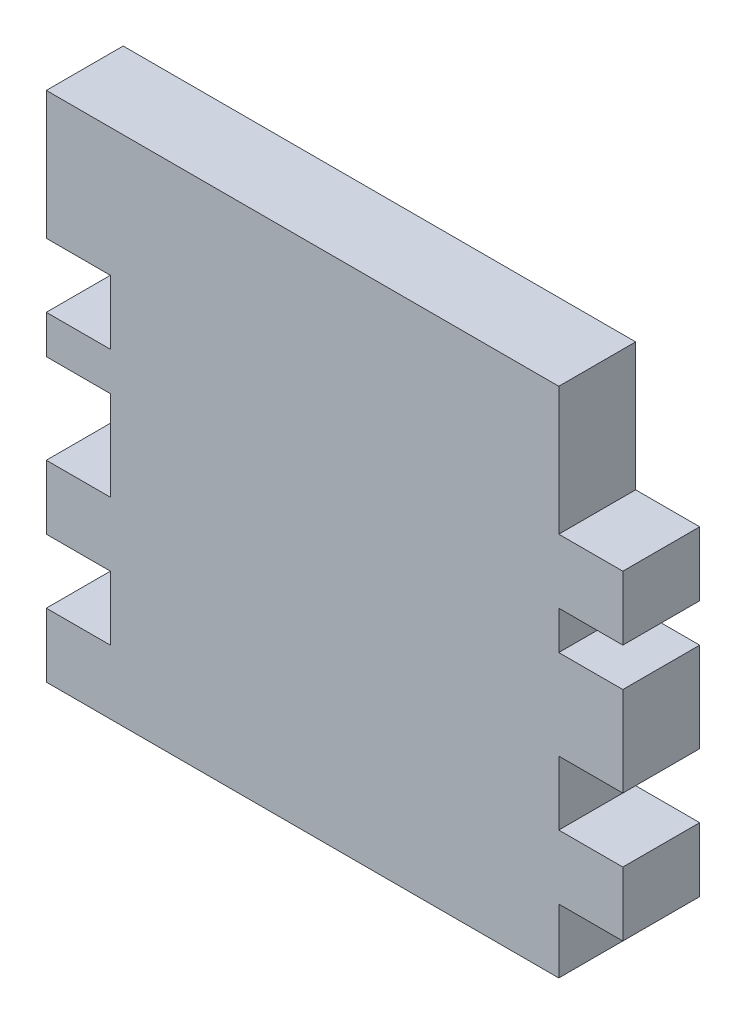
from build123d import *

# Parameters (mm, degrees)
SKETCH1_W           = 45
SKETCH1_H           = 40
BOSS_EXTRUDE1_DEPTH = 6
SKETCH2_W           = 5
SKETCH2_H           = 5
SKETCH2_H_2         = 7
CUT_EXTRUDE1_DEPTH  = 6
SKETCH3_W           = 5
SKETCH3_H           = 5
SKETCH3_H_2         = 7
CUT_EXTRUDE3_DEPTH  = 6
SKETCH3_4_W         = 5
SKETCH3_4_H         = 5
SKETCH3_4_H_2       = 7
BOSS_EXTRUDE3_DEPTH = 6
SKETCH3_5_W         = 5
SKETCH3_5_H         = 3
SKETCH3_5_H_2       = 10
SKETCH3_5_H_3       = 5
CUT_EXTRUDE4_DEPTH  = 6
SKETCH4_W           = 5
SKETCH4_H           = 2
CUT_EXTRUDE10_DEPTH = 10
SKETCH5_W           = 5
SKETCH5_H           = 5
BOSS_EXTRUDE4_DEPTH = 6


with BuildPart() as part:
    # Sketch1 → Boss-Extrude1 (new body)
    with BuildSketch(Plane.XY):
        with Locations((4.06626506, -2.515060241)):
            Rectangle(SKETCH1_W, SKETCH1_H)
    extrude(amount=BOSS_EXTRUDE1_DEPTH)

    # Sketch2 → Cut-Extrude1 (cut)
    with BuildSketch(Plane.XY.offset(6)):
        with Locations((-15.93373494, 4.984939759)):
            Rectangle(SKETCH2_W, SKETCH2_H)
        with Locations((-15.93373494, -6.015060241)):
            Rectangle(SKETCH2_W, SKETCH2_H_2)
        with Locations((-15.93373494, -15.015060241)):
            Rectangle(SKETCH2_W, SKETCH2_H)
    extrude(amount=-CUT_EXTRUDE1_DEPTH, mode=Mode.SUBTRACT)

    # Sketch3 → Cut-Extrude3 (cut)
    with BuildSketch(Plane.XY.offset(6)):
        with Locations((24.06626506, 4.984939759)):
            Rectangle(SKETCH3_W, SKETCH3_H)
        with Locations((24.06626506, -4.015060241)):
            Rectangle(SKETCH3_W, SKETCH3_H_2)
        with Locations((24.06626506, -15.015060241)):
            Rectangle(SKETCH3_W, SKETCH3_H)
    extrude(amount=-CUT_EXTRUDE3_DEPTH, mode=Mode.SUBTRACT)

    # Sketch3<4> → Boss-Extrude3 (add)
    with BuildSketch(Plane.XY.offset(6)):
        with Locations((24.06626506, 4.984939759)):
            Rectangle(SKETCH3_4_W, SKETCH3_4_H)
        with Locations((24.06626506, -4.015060241)):
            Rectangle(SKETCH3_4_W, SKETCH3_4_H_2)
        with Locations((24.06626506, -15.015060241)):
            Rectangle(SKETCH3_4_W, SKETCH3_4_H)
    extrude(amount=-BOSS_EXTRUDE3_DEPTH)

    # Sketch3<5> → Cut-Extrude4 (cut)
    with BuildSketch(Plane.XY.offset(6)):
        with Locations((24.06626506, 0.984939759)):
            Rectangle(SKETCH3_5_W, SKETCH3_5_H)
        with Locations((24.06626506, 12.484939759)):
            Rectangle(SKETCH3_5_W, SKETCH3_5_H_2)
        with Locations((24.06626506, -10.015060241)):
            Rectangle(SKETCH3_5_W, SKETCH3_5_H_3)
        with Locations((24.06626506, -20.015060241)):
            Rectangle(SKETCH3_5_W, SKETCH3_5_H_3)
    extrude(amount=-CUT_EXTRUDE4_DEPTH, mode=Mode.SUBTRACT)

    # Sketch4 → Cut-Extrude10 (cut)
    with BuildSketch(Plane.XY.offset(6)):
        with Locations((-15.93373494, -1.515060241)):
            Rectangle(SKETCH4_W, SKETCH4_H)
    extrude(amount=-CUT_EXTRUDE10_DEPTH, mode=Mode.SUBTRACT)

    # Sketch5 → Boss-Extrude4 (add)
    with BuildSketch(Plane.XY.offset(6)):
        with Locations((-15.93373494, -10.015060241)):
            Rectangle(SKETCH5_W, SKETCH5_H)
    extrude(amount=-BOSS_EXTRUDE4_DEPTH)


solid = part.part
